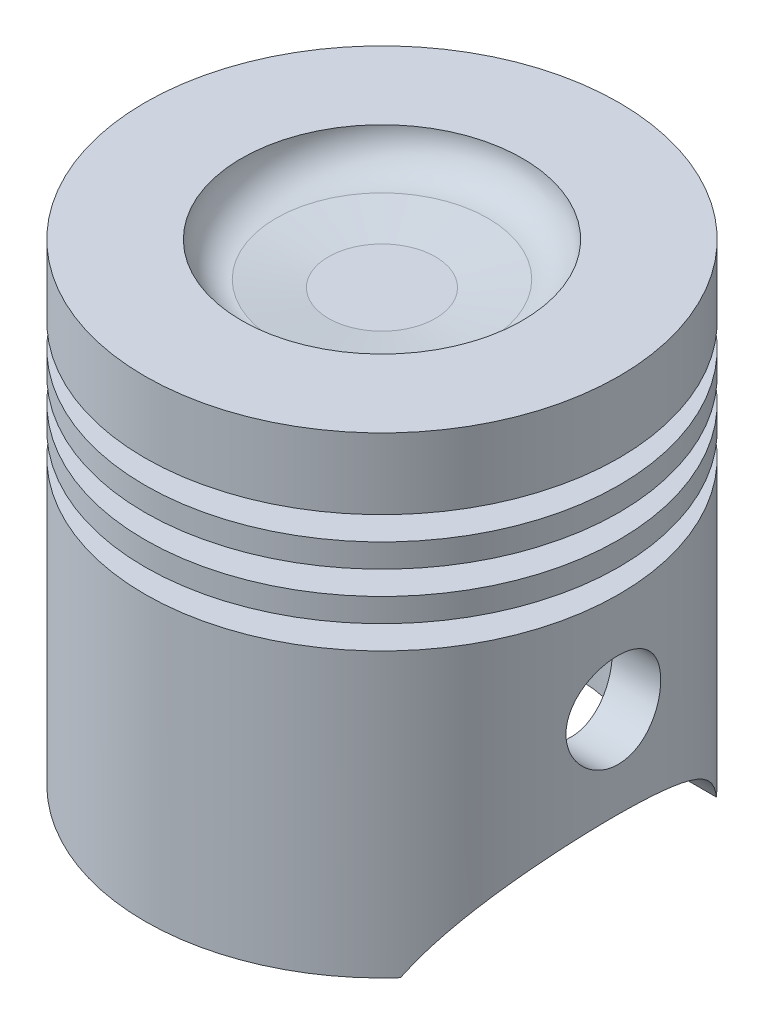
from build123d import *

# Parameters (mm, degrees)
CUT_EXTRUDE1_DEPTH      = 60
CUT_EXTRUDE1_DEPTH_BACK = 60
SKETCH2_R               = 10


with BuildPart() as part:
    # Sketch1 → Revolve1 (revolve)
    with BuildSketch(Plane.XY, mode=Mode.PRIVATE) as revolve1_sk:
        with BuildLine():
            Line((-50.213491879, 0), (-50.213491879, 60))
            Line((-50.213491879, 60), (-43.142539091, 60))
            Line((-43.142539091, 60), (-43.142539091, 65))
            Line((-43.142539091, 65), (-50.213491879, 65))
            Line((-50.213491879, 65), (-50.213491879, 70))
            Line((-50.213491879, 70), (-43.142539091, 70))
            Line((-43.142539091, 70), (-43.142539091, 75))
            Line((-43.142539091, 75), (-50.213491879, 75))
            Line((-50.213491879, 75), (-50.213491879, 80))
            Line((-50.213491879, 80), (-43.142539091, 80))
            Line((-43.142539091, 80), (-43.142539091, 85))
            Line((-43.142539091, 85), (-50.213491879, 85))
            Line((-50.213491879, 85), (-50.213491879, 100))
            Line((-50.213491879, 100), (-29.758235601, 100))
            ThreePointArc((-29.758235601, 100), (-27.613235974, 94.821512811), (-22.434748785, 92.676513184))
            Line((-22.434748785, 92.676513184), (-11.323251547, 91.161309016))
            Line((-11.323251547, 91.161309016), (0, 91.161309016))
            Line((0, 91.161309016), (0, 0))
            Line((0, 0), (-50.213491879, 0))
        make_face()
    revolve(revolve1_sk.sketch.rotate(Axis((0, 116.04188361, 0), (0, -1, 0)), 270), axis=Axis((0, 116.04188361, 0), (0, -1, 0)))

    # Shell1: read off the stored shape, not the designer's step
    # Shell1 outline → Shell1 (revolve, cut)
    with BuildSketch(Plane.XY):
        with BuildLine():
            Line((12.001929251, 81.161309016), (0, 81.161309016))
            Line((0, 81.161309016), (0, 0))
            Line((0, 0), (40.213491879, 0))
            Line((40.213491879, 0), (40.213491879, 50))
            Line((40.213491879, 50), (33.142539091, 50))
            Line((33.142539091, 50), (33.142539091, 86.382128573))
            ThreePointArc((33.142539091, 86.382128573), (28.486928042, 83.768107883), (23.256399997, 82.696009572))
            Line((23.256399997, 82.696009572), (12.001929251, 81.161309016))
        make_face()
    revolve(axis=Axis((0, 0, 0), (0, 1, 0)), mode=Mode.SUBTRACT)

    # Sketch2 → Cut-Extrude1 (cut, two sides: drawn at the far end of the back side and taken through both)
    with BuildSketch(Plane(origin=(0, 0, 0), x_dir=(0, 0, -1), z_dir=(1, 0, 0)).offset(-CUT_EXTRUDE1_DEPTH_BACK)):
        with Locations(Location((-0.200994326, 38.878313976, 0), (0, 0, 180))):
            Circle(SKETCH2_R)
        with BuildLine():
            Line((-33.49905429, 0), (33.097065639, 0))
            ThreePointArc((33.097065639, 0), (-0.200994326, 19.719751163), (-33.49905429, 0))
        make_face()
    extrude(amount=CUT_EXTRUDE1_DEPTH + CUT_EXTRUDE1_DEPTH_BACK, mode=Mode.SUBTRACT)


solid = part.part
